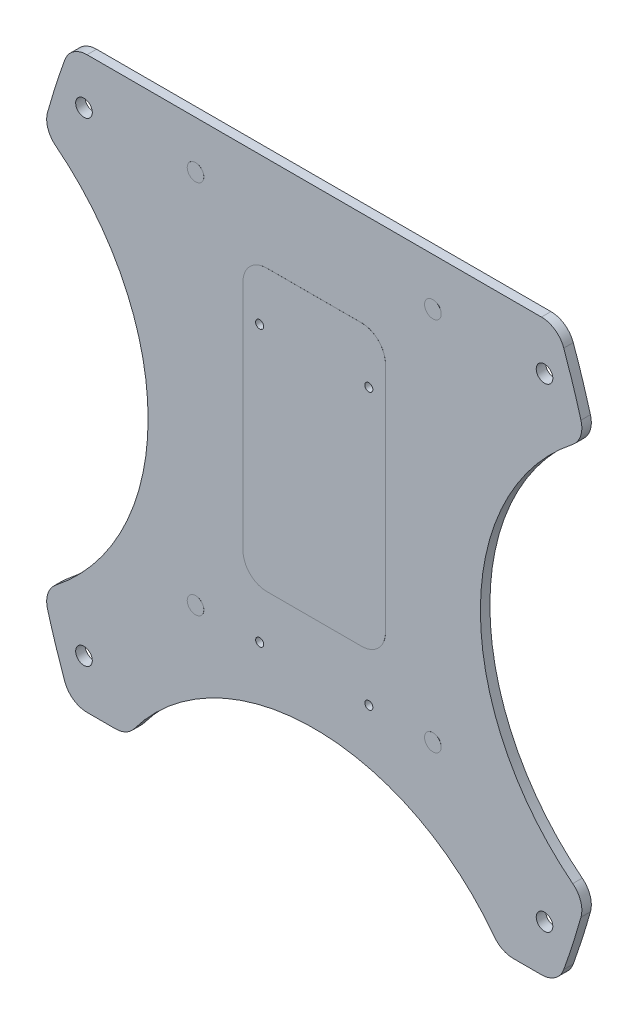
from build123d import *

# Parameters (mm, degrees)
IMPORTED_START                     = -42
IMPORTED_BODY_1_OUTLINE_R          = 1.75
IMPORTED_BODY_1_DEPTH              = 2
EXTRUDE_START                      = -2.01012
SKETCH_1_R                         = 1.75
EXTRUDE_1_DEPTH                    = 2.01012
SKETCH_2_R                         = 2.5
SKETCH_2_R_2                       = 0.85
EXTRUDE_2_DEPTH                    = 5
FILLET_1_R                         = 1
CHAMFER_1_SIZE                     = 0.6
SKETCH_3_R                         = 0.85
CUT_EXTRUDE_1_DEPTH                = 83.477440833
PATTERN_LINEAR_1_COUNT             = 2
PATTERN_LINEAR_1_PITCH             = 58
PATTERN_LINEAR_1_COUNT_DIR2        = 2
PATTERN_LINEAR_1_PITCH_DIR2        = 23
FILLET_1_OF_PATTERN_LINEAR_1_R     = 1
CHAMFER_1_OF_PATTERN_LINEAR_1_SIZE = 0.6


# Read off the part's stored shape, not the designer's step: Заготовка-Основание-1
with BuildPart() as part:
    # Заготовка-Основание-1 outline → Заготовка-Основание-1 (new body)
    with BuildSketch(Plane.XY.offset(IMPORTED_START)):
        with BuildLine():
            add(Edge.make_bspline(
                [(-52.567338158, -56.687092755), (-53.907083637, -52.949373723), (-55.113256729, -49.167125614), (-56.183975236, -45.347636311)],
                knots=[0.154838503, 0.154838503, 0.154838503, 0.154838503, 0.226015104, 0.226015104, 0.226015104, 0.226015104], degree=3))
            ThreePointArc((-52.567338158, -56.687092755), (-50.738457524, -59.088732308), (-47.860564525, -60))
            Line((-47.860564525, -60), (-41.924542191, -60))
            ThreePointArc((-41.924542191, -60), (-39.685256286, -59.470525543), (-37.920228255, -57.994239454))
            ThreePointArc((-37.920228255, -57.994239454), (0, -39), (37.920228255, -57.994239454))
            ThreePointArc((37.920228255, -57.994239454), (39.685256286, -59.470525543), (41.924542191, -60))
            Line((41.924542191, -60), (47.860564525, -60))
            ThreePointArc((47.860564525, -60), (50.738457524, -59.088732308), (52.567338158, -56.687092755))
            add(Edge.make_bspline(
                [(56.183975236, -45.347636311), (55.113256729, -49.167125614), (53.907083637, -52.949373723), (52.567338158, -56.687092755)],
                knots=[0.773984896, 0.773984896, 0.773984896, 0.773984896, 0.845161497, 0.845161497, 0.845161497, 0.845161497], degree=3))
            ThreePointArc((56.183975236, -45.347636311), (56.122806116, -42.446648473), (54.460846844, -40.068127194))
            ThreePointArc((54.460846844, -40.068127194), (35, 6e-09), (54.460846854, 40.068127202))
            ThreePointArc((54.460846854, 40.068127202), (56.122806127, 42.446648481), (56.183975247, 45.34763632))
            add(Edge.make_bspline(
                [(52.567338167, 56.687092757), (53.907083647, 52.949373727), (55.113256739, 49.167125621), (56.183975247, 45.34763632)],
                knots=[0.15483858, 0.15483858, 0.15483858, 0.15483858, 0.226015181, 0.226015181, 0.226015181, 0.226015181], degree=3))
            ThreePointArc((52.567338167, 56.687092757), (50.738457533, 59.088732309), (47.860564535, 60))
            Line((47.860564535, 60), (-47.860564535, 60))
            ThreePointArc((-47.860564535, 60), (-50.738457533, 59.088732309), (-52.567338167, 56.687092757))
            add(Edge.make_bspline(
                [(-56.183975247, 45.34763632), (-55.113256739, 49.167125621), (-53.907083647, 52.949373727), (-52.567338167, 56.687092757)],
                knots=[0.773984819, 0.773984819, 0.773984819, 0.773984819, 0.84516142, 0.84516142, 0.84516142, 0.84516142], degree=3))
            ThreePointArc((-56.183975247, 45.34763632), (-56.122806127, 42.446648481), (-54.460846854, 40.068127202))
            ThreePointArc((-54.460846854, 40.068127202), (-35, 6e-09), (-54.460846844, -40.068127194))
            ThreePointArc((-54.460846844, -40.068127194), (-56.122806116, -42.446648473), (-56.183975236, -45.347636311))
        make_face()
        with Locations((-48.510868396, -50)):
            Circle(IMPORTED_BODY_1_OUTLINE_R, mode=Mode.SUBTRACT)
        with Locations((-25, -29)):
            Circle(IMPORTED_BODY_1_OUTLINE_R, mode=Mode.SUBTRACT)
        with Locations((48.510868396, -50)):
            Circle(IMPORTED_BODY_1_OUTLINE_R, mode=Mode.SUBTRACT)
        with Locations((25, -29)):
            Circle(IMPORTED_BODY_1_OUTLINE_R, mode=Mode.SUBTRACT)
        with Locations((-48.510868396, 50)):
            Circle(IMPORTED_BODY_1_OUTLINE_R, mode=Mode.SUBTRACT)
        with Locations((-25, 50)):
            Circle(IMPORTED_BODY_1_OUTLINE_R, mode=Mode.SUBTRACT)
        with BuildLine():
            Line((-15, -14), (-15, 35))
            ThreePointArc((-15, 35), (-13.535533906, 38.535533906), (-10, 40))
            Line((-10, 40), (10, 40))
            ThreePointArc((10, 40), (13.535533906, 38.535533906), (15, 35))
            Line((15, 35), (15, -14))
            ThreePointArc((15, -14), (13.535533906, -17.535533906), (10, -19))
            Line((10, -19), (-10, -19))
            ThreePointArc((-10, -19), (-13.535533906, -17.535533906), (-15, -14))
        make_face(mode=Mode.SUBTRACT)
        with Locations((25, 50)):
            Circle(IMPORTED_BODY_1_OUTLINE_R, mode=Mode.SUBTRACT)
        with Locations((48.510868396, 50)):
            Circle(IMPORTED_BODY_1_OUTLINE_R, mode=Mode.SUBTRACT)
    extrude(amount=IMPORTED_BODY_1_DEPTH)

    # Эскиз1 → Бобышка-Вытянуть1 (add)
    with BuildSketch(Plane(origin=(0, 0, -42), x_dir=(-1, 0, 0), z_dir=(0, 0, -1)).offset(EXTRUDE_START)):
        with Locations((-25, -29)):
            Circle(SKETCH_1_R)
        with Locations((25, -29)):
            Circle(SKETCH_1_R)
        with Locations((25, 50)):
            Circle(SKETCH_1_R)
        with Locations((-25, 50)):
            Circle(SKETCH_1_R)
        with BuildLine():
            Line((-10, -19), (10, -19))
            ThreePointArc((10, -19), (13.535533906, -17.535533906), (15, -14))
            Line((15, -14), (15, 35))
            ThreePointArc((15, 35), (13.535533906, 38.535533906), (10, 40))
            Line((10, 40), (-10, 40))
            ThreePointArc((-10, 40), (-13.535533906, 38.535533906), (-15, 35))
            Line((-15, 35), (-15, -14))
            ThreePointArc((-15, -14), (-13.535533906, -17.535533906), (-10, -19))
        make_face()
    extrude(amount=EXTRUDE_1_DEPTH)

    # Эскиз2 → Бобышка-Вытянуть2 (add)
    with BuildSketch(Plane(origin=(0, 0, -42), x_dir=(-1, 0, 0), z_dir=(0, 0, -1))):
        with Locations((-11.5, 29)):
            Circle(SKETCH_2_R)
        with Locations((-11.5, 29)):
            Circle(SKETCH_2_R_2, mode=Mode.SUBTRACT)
    extrude_2 = extrude(amount=EXTRUDE_2_DEPTH)

    # Скругление1
    fillet_1_edges = [part.edges().sort_by_distance(p)[0] for p in [
        (14, 29, -42),
    ]]
    fillet(fillet_1_edges, radius=FILLET_1_R)

    # Фаска1
    chamfer_1_edges = [part.edges().sort_by_distance(p)[0] for p in [
        (12.35, 29, -47),
    ]]
    chamfer(chamfer_1_edges, length=CHAMFER_1_SIZE)

    # Эскиз3 → Вырез-Вытянуть1 (cut, through all)
    with BuildSketch(Plane(origin=(0, 0, -42), x_dir=(-1, 0, 0), z_dir=(0, 0, -1))):
        with Locations((-11.5, 29)):
            Circle(SKETCH_3_R)
    cut_extrude_1 = extrude(amount=-CUT_EXTRUDE_1_DEPTH, mode=Mode.SUBTRACT)

    # Линейный массив1: Бобышка-Вытянуть2, Cut-Extrude 1 2 × 2
    with Locations(*[(-j * PATTERN_LINEAR_1_PITCH_DIR2, -i * PATTERN_LINEAR_1_PITCH, 0) for i in range(PATTERN_LINEAR_1_COUNT) for j in range(PATTERN_LINEAR_1_COUNT_DIR2) if (i, j) != (0, 0)]):
        add(extrude_2)
        add(cut_extrude_1, mode=Mode.SUBTRACT)

    # Скругление1 of Линейный массив1
    fillet_1_of_pattern_linear_1_edges = [part.edges().sort_by_distance(p)[0] for p in [
        (-9, 29, -42),
        (14, -29, -42),
        (-9, -29, -42),
    ]]
    fillet(fillet_1_of_pattern_linear_1_edges, radius=FILLET_1_OF_PATTERN_LINEAR_1_R)

    # Фаска1 of Линейный массив1
    chamfer_1_of_pattern_linear_1_edges = [part.edges().sort_by_distance(p)[0] for p in [
        (-10.65, 29, -47),
        (12.35, -29, -47),
        (-10.65, -29, -47),
    ]]
    chamfer(chamfer_1_of_pattern_linear_1_edges, length=CHAMFER_1_OF_PATTERN_LINEAR_1_SIZE)


solid = part.part
